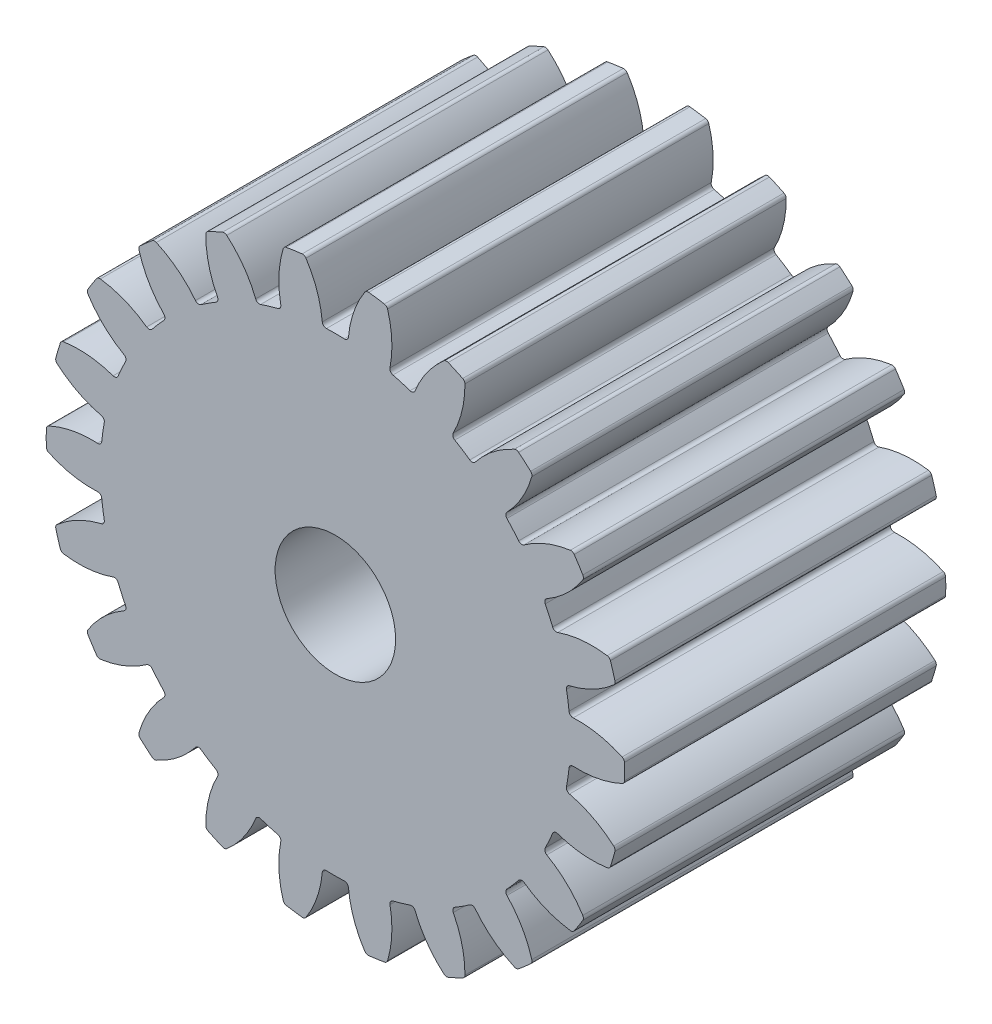
from build123d import *

# Parameters (mm, degrees)
SKETCH_1_R                       = 7.2
SKETCH_1_R_2                     = 1.5
EXTRUDE_1_DEPTH                  = 4
CUT_EXTRUDE_1_DEPTH              = 11.939835465
FILLET_1_R                       = 0.1
PATTERN_CIRCULAR_1_COUNT         = 22
FILLET_1_OF_PATTERN_CIRCULAR_1_R = 0.1


with BuildPart() as part:
    # Эскиз1 → Бобышка-Вытянуть1 (new, symmetric)
    with BuildSketch(Plane.XY):
        Circle(SKETCH_1_R)
        Circle(SKETCH_1_R_2, mode=Mode.SUBTRACT)
    extrude(amount=EXTRUDE_1_DEPTH, both=True)

    # Эскиз2 → Вырез-Вытянуть1 (cut, symmetric)
    with BuildSketch(Plane.XY):
        with BuildLine():
            ThreePointArc((0.319047222, 5.841293424), (0, 5.85), (-0.319047222, 5.841293424))
            ThreePointArc((-0.319047222, 5.841293424), (-0.452451681, 6.530927866), (-0.766877503, 7.159043155))
            ThreePointArc((-0.766877503, 7.159043155), (0, 7.2), (0.766877503, 7.159043155))
            ThreePointArc((0.766877503, 7.159043155), (0.452451681, 6.530927866), (0.319047222, 5.841293424))
        make_face()
    cut_extrude_1 = extrude(amount=CUT_EXTRUDE_1_DEPTH, both=True, mode=Mode.SUBTRACT)

    # Скругление1
    fillet_1_edges = [part.edges().sort_by_distance(p)[0] for p in [
        (0.766877503, 7.159043155, 0),
        (0.319047222, 5.841293424, 0),
        (-0.319047222, 5.841293424, 0),
        (-0.766877503, 7.159043155, 0),
    ]]
    fillet(fillet_1_edges, radius=FILLET_1_R)

    # Круговой массив1: Вырез-Вытянуть1 ×22 about axis
    pattern_circular_1_axis = Axis((0, 0, 4), (0, 0, -1))
    for i in range(1, PATTERN_CIRCULAR_1_COUNT):
        add(cut_extrude_1.rotate(pattern_circular_1_axis, i * 360 / PATTERN_CIRCULAR_1_COUNT), mode=Mode.SUBTRACT)

    # Скругление1 of Круговой массив1
    fillet_1_of_pattern_circular_1_edges = [part.edges().sort_by_distance(p)[0] for p in [
        (2.752749108, 6.652997245, 0),
        (1.951806099, 5.514794008, 0),
        (1.339558964, 5.694565987, 0),
        (1.281121957, 7.085105965, 0),
        (4.515609352, 5.607965066, 0),
        (3.426441255, 4.741518779, 0),
        (2.889642049, 5.08649868, 0),
        (3.225332535, 6.437175626, 0),
        (5.912641782, 4.108608908, 0),
        (4.623486517, 3.584113897, 0),
        (4.205623521, 4.066353501, 0),
        (4.908245853, 5.267743601, 0),
        (6.830667138, 2.276397692, 0),
        (5.445964399, 2.136345423, 0),
        (5.180890387, 2.716776545, 0),
        (6.193522282, 3.671550319, 0),
        (7.195312466, 0.259766273, 0),
        (5.827242634, 0.515502948, 0),
        (5.736432326, 1.14710251, 0),
        (6.97703637, 1.777909865, 0),
        (6.97703637, -1.777909865, 0),
        (5.736432326, -1.14710251, 0),
        (5.827242634, -0.515502948, 0),
        (7.195312466, -0.259766273, 0),
        (6.193522282, -3.671550319, 0),
        (5.180890387, -2.716776545, 0),
        (5.445964399, -2.136345423, 0),
        (6.830667138, -2.276397692, 0),
        (4.908245853, -5.267743601, 0),
        (4.205623521, -4.066353501, 0),
        (4.623486517, -3.584113897, 0),
        (5.912641782, -4.108608908, 0),
        (3.225332535, -6.437175626, 0),
        (2.889642049, -5.08649868, 0),
        (3.426441255, -4.741518779, 0),
        (4.515609352, -5.607965066, 0),
        (1.281121957, -7.085105965, 0),
        (1.339558964, -5.694565987, 0),
        (1.951806099, -5.514794008, 0),
        (2.752749108, -6.652997245, 0),
        (-0.766877503, -7.159043155, 0),
        (-0.319047222, -5.841293424, 0),
        (0.319047222, -5.841293424, 0),
        (0.766877503, -7.159043155, 0),
        (-2.752749108, -6.652997245, 0),
        (-1.951806099, -5.514794008, 0),
        (-1.339558964, -5.694565987, 0),
        (-1.281121957, -7.085105965, 0),
        (-4.515609352, -5.607965066, 0),
        (-3.426441255, -4.741518779, 0),
        (-2.889642049, -5.08649868, 0),
        (-3.225332535, -6.437175626, 0),
        (-5.912641782, -4.108608908, 0),
        (-4.623486517, -3.584113897, 0),
        (-4.205623521, -4.066353501, 0),
        (-4.908245853, -5.267743601, 0),
        (-6.830667138, -2.276397692, 0),
        (-5.445964399, -2.136345423, 0),
        (-5.180890387, -2.716776545, 0),
        (-6.193522282, -3.671550319, 0),
        (-7.195312466, -0.259766273, 0),
        (-5.827242634, -0.515502948, 0),
        (-5.736432326, -1.14710251, 0),
        (-6.97703637, -1.777909865, 0),
        (-6.97703637, 1.777909865, 0),
        (-5.736432326, 1.14710251, 0),
        (-5.827242634, 0.515502948, 0),
        (-7.195312466, 0.259766273, 0),
        (-6.193522282, 3.671550319, 0),
        (-5.180890387, 2.716776545, 0),
        (-5.445964399, 2.136345423, 0),
        (-6.830667138, 2.276397692, 0),
        (-4.908245853, 5.267743601, 0),
        (-4.205623521, 4.066353501, 0),
        (-4.623486517, 3.584113897, 0),
        (-5.912641782, 4.108608908, 0),
        (-3.225332535, 6.437175626, 0),
        (-2.889642049, 5.08649868, 0),
        (-3.426441255, 4.741518779, 0),
        (-4.515609352, 5.607965066, 0),
        (-1.281121957, 7.085105965, 0),
        (-1.339558964, 5.694565987, 0),
        (-1.951806099, 5.514794008, 0),
        (-2.752749108, 6.652997245, 0),
    ]]
    fillet(fillet_1_of_pattern_circular_1_edges, radius=FILLET_1_OF_PATTERN_CIRCULAR_1_R)


solid = part.part
